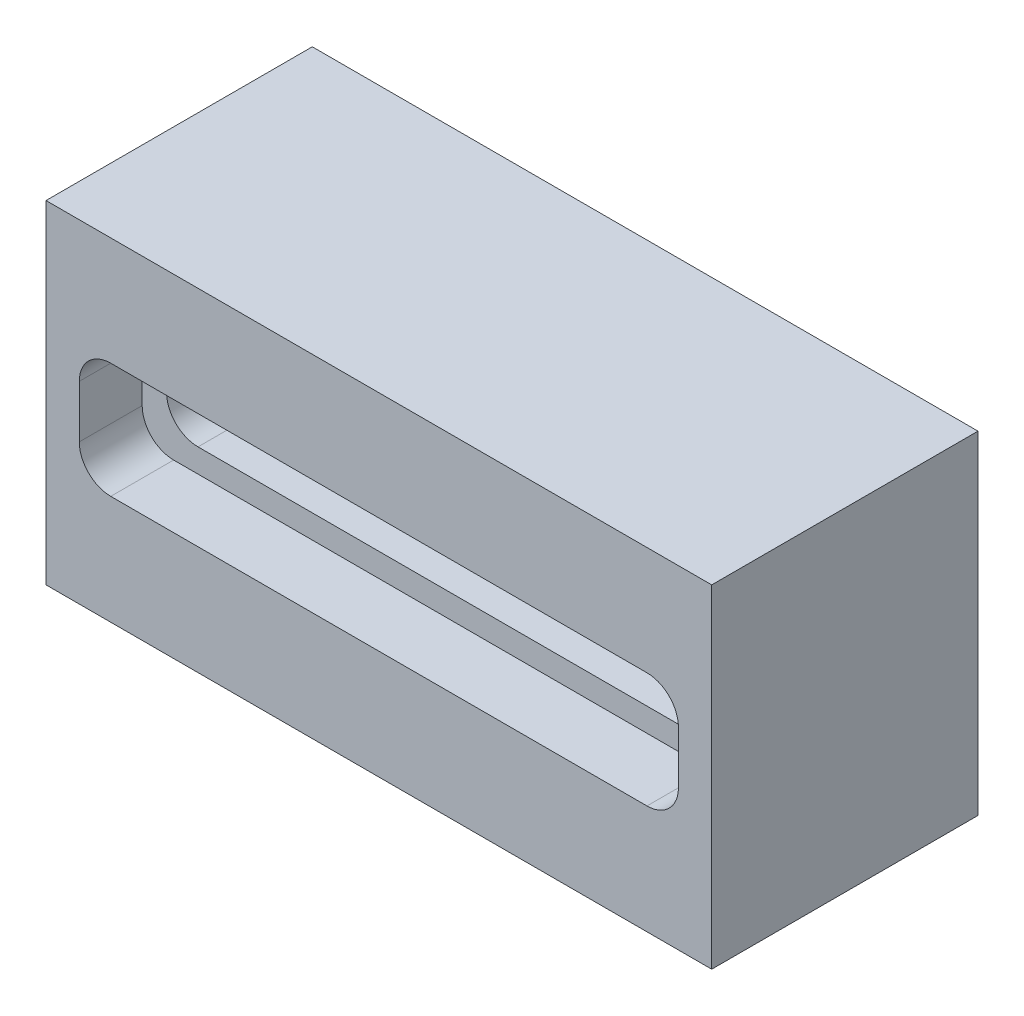
from build123d import *

# Parameters (mm, degrees)
SKETCH1_W           = 127
SKETCH1_H           = 50.8
BOSS_EXTRUDE1_DEPTH = 63.5
CUT_EXTRUDE2_DEPTH  = 12
CUT_EXTRUDE3_DEPTH  = 151.804144505


with BuildPart() as part:
    # Sketch1 → Boss-Extrude1 (new body)
    with BuildSketch(Plane(origin=(0, 0, 0), x_dir=(1, 0, 0), z_dir=(0, 1, 0))):
        with Locations((63.5, 25.4)):
            Rectangle(SKETCH1_W, SKETCH1_H)
    extrude(amount=BOSS_EXTRUDE1_DEPTH)

    # Sketch3 → Cut-Extrude2 (cut)
    with BuildSketch(Plane.XY):
        with BuildLine():
            Line((12.35, 42.8), (114.65, 42.8))
            ThreePointArc((114.65, 42.8), (118.892640687, 41.042640687), (120.65, 36.8))
            Line((120.65, 36.8), (120.65, 26.8))
            ThreePointArc((120.65, 26.8), (118.892640687, 22.557359313), (114.65, 20.8))
            Line((114.65, 20.8), (12.35, 20.8))
            ThreePointArc((12.35, 20.8), (8.107359313, 22.557359313), (6.35, 26.8))
            Line((6.35, 26.8), (6.35, 36.8))
            ThreePointArc((6.35, 36.8), (8.107359313, 41.042640687), (12.35, 42.8))
        make_face()
    extrude(amount=-CUT_EXTRUDE2_DEPTH, mode=Mode.SUBTRACT)

    # Sketch2 → Cut-Extrude3 (cut, through all)
    with BuildSketch(Plane.XY):
        with BuildLine():
            Line((17, 38.3), (110, 38.3))
            ThreePointArc((110, 38.3), (114.242640687, 36.542640687), (116, 32.3))
            Line((116, 32.3), (116, 31.3))
            ThreePointArc((116, 31.3), (114.242640687, 27.057359313), (110, 25.3))
            Line((110, 25.3), (17, 25.3))
            ThreePointArc((17, 25.3), (12.757359313, 27.057359313), (11, 31.3))
            Line((11, 31.3), (11, 32.3))
            ThreePointArc((11, 32.3), (12.757359313, 36.542640687), (17, 38.3))
        make_face()
    extrude(amount=-CUT_EXTRUDE3_DEPTH, mode=Mode.SUBTRACT)


solid = part.part
